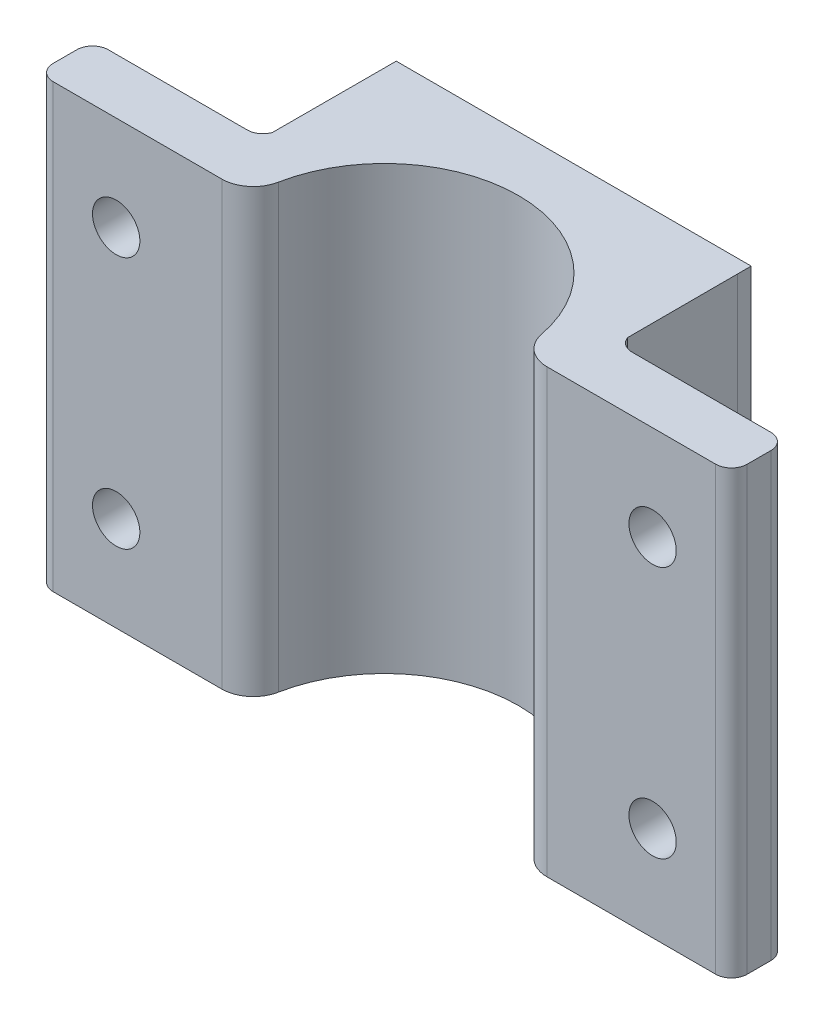
from build123d import *

# Parameters (mm, degrees)
BOSS_EXTRUDE1_DEPTH   = 28
FILLET1_R             = 2
FILLET2_R             = 1
FILLET3_R             = 1
BOSS_EXTRUDE2_START   = -28
BOSS_EXTRUDE2_DEPTH   = 28
SKETCH4_R             = 1.75
CUT_EXTRUDE2_DEPTH    = 3.5
F_3_0MM_DOWEL_HOLE1_D = 3


with BuildPart() as part:
    # Sketch1 → Boss-Extrude1 (new body)
    with BuildSketch(Plane(origin=(0, 0, 0), x_dir=(1, 0, 0), z_dir=(0, 1, 0))):
        with BuildLine():
            Line((-22, 0), (-8.5, 0))
            ThreePointArc((-8.5, 0), (0, 8.5), (8.5, 0))
            Line((8.5, 0), (22, 0))
            Line((22, 0), (22, 3.5))
            Line((22, 3.5), (11.478240283, 3.5))
            ThreePointArc((11.478240283, 3.5), (0, 12), (-11.478240283, 3.5))
            Line((-11.478240283, 3.5), (-22, 3.5))
            Line((-22, 3.5), (-22, 0))
        make_face()
    extrude(amount=BOSS_EXTRUDE1_DEPTH)

    # Fillet1
    fillet1_edges = [part.edges().sort_by_distance(p)[0] for p in [
        (8.5, 14, 0),
        (-8.5, 14, 0),
    ]]
    fillet(fillet1_edges, radius=FILLET1_R)

    # Fillet2
    fillet2_edges = [part.edges().sort_by_distance(p)[0] for p in [
        (11.478240283, 14, -3.5),
        (-11.478240283, 14, -3.5),
    ]]
    fillet(fillet2_edges, radius=FILLET2_R)

    # Fillet3
    fillet3_edges = [part.edges().sort_by_distance(p)[0] for p in [
        (-22, 14, 0),
        (-22, 14, -3.5),
        (22, 14, 0),
        (22, 14, -3.5),
    ]]
    fillet(fillet3_edges, radius=FILLET3_R)

    # Sketch3 → Boss-Extrude2 (add)
    with BuildSketch(Plane(origin=(0, 28, 0), x_dir=(1, 0, 0), z_dir=(0, 1, 0)).offset(BOSS_EXTRUDE2_START)):
        with BuildLine():
            Line((11.25, 12), (2.9e-08, 12))
            ThreePointArc((2.9e-08, 12), (6.861262511, 9.844951841), (11.258133155, 4.153846154))
            Line((11.258133155, 4.153846154), (11.25, 11.146278764))
            Line((11.25, 11.146278764), (11.25, 12))
        make_face()
        with BuildLine():
            Line((-11.25, 12), (-11.25, 11.146278764))
            Line((-11.25, 11.146278764), (-11.258133155, 4.153846154))
            ThreePointArc((-11.258133155, 4.153846154), (-6.861262487, 9.844951858), (2.9e-08, 12))
            Line((2.9e-08, 12), (-11.25, 12))
        make_face()
    extrude(amount=BOSS_EXTRUDE2_DEPTH)

    # Sketch4 → Cut-Extrude2 (cut)
    with BuildSketch(Plane(origin=(0, 0, -12), x_dir=(-1, 0, 0), z_dir=(0, 0, -1))):
        with Locations((7.62, 3.2)):
            Circle(SKETCH4_R)
        with Locations((7.62, 24.795)):
            Circle(SKETCH4_R)
        with Locations((-7.62, 24.795)):
            Circle(SKETCH4_R)
        with Locations((-7.62, 3.2)):
            Circle(SKETCH4_R)
    extrude(amount=-CUT_EXTRUDE2_DEPTH, mode=Mode.SUBTRACT)

    # Ø3.0mm Dowel Hole1 (through all)
    with Locations(Plane(origin=(-17, 6, -3.5), x_dir=(-1, 0, 0), z_dir=(0, 0, -1))):
        with Locations((0, 0), (0, 16), (-34, 16), (-34, 0)):
            Hole(F_3_0MM_DOWEL_HOLE1_D / 2)


solid = part.part
